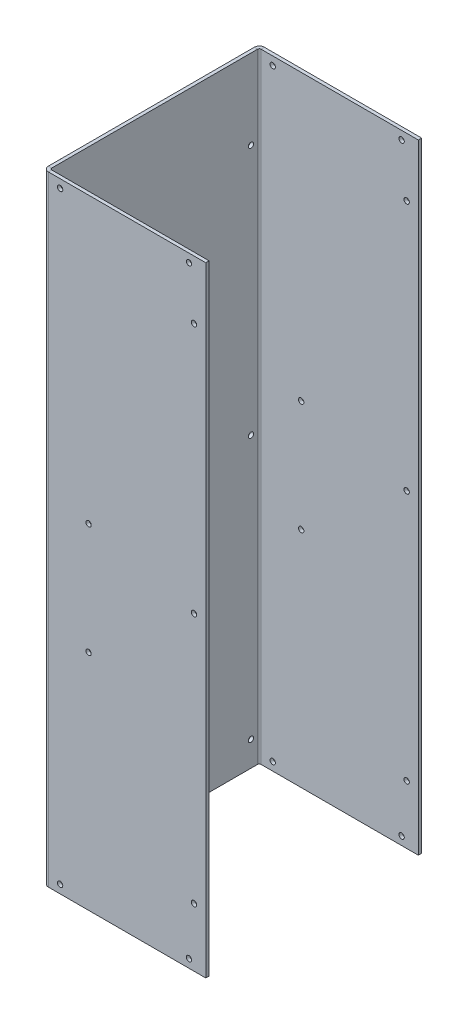
from build123d import *

# Parameters (mm, degrees)
SKETCH1_W                      = 370
SKETCH1_H                      = 129
SKETCH1_R                      = 1.6
BASE_FLANGE2_DEPTH             = 2
EDGE_FLANGE2_STRIP_W           = 9.9304
EDGE_FLANGE2_STRIP_H           = 2
EDGE_FLANGE2_STRIP_CUT_DEPTH   = 370
EDGE_FLANGE2_STRIP_2_W         = 9.9304
EDGE_FLANGE2_STRIP_2_H         = 2
EDGE_FLANGE2_STRIP_CUT_2_DEPTH = 370
EDGE_FLANGE2_DEPTH             = 370
EDGE_FLANGE2_BEND_DEPTH        = 370
SKETCH23_R                     = 1.6
CUT_EXTRUDE2_DEPTH             = 245.726377818


# Sheet-metal steps are written as plain solids
with BuildPart() as part:
    # Sketch1 → Base-Flange2 (new body)
    with BuildSketch(Plane.YZ):
        Rectangle(SKETCH1_W, SKETCH1_H)
        with Locations(Location((-170, 57.5, 0), (0, 0, 270))):
            Circle(SKETCH1_R, mode=Mode.SUBTRACT)
        with Locations(Location((137.3, 57.5, 0), (0, 0, 270))):
            Circle(SKETCH1_R, mode=Mode.SUBTRACT)
        with Locations(Location((-170, -57.5, 0), (0, 0, 270))):
            Circle(SKETCH1_R, mode=Mode.SUBTRACT)
        with Locations(Location((137.3, -57.5, 0), (0, 0, 270))):
            Circle(SKETCH1_R, mode=Mode.SUBTRACT)
        with Locations(Location((34.3, 57.5, 0), (0, 0, 270))):
            Circle(SKETCH1_R, mode=Mode.SUBTRACT)
        with Locations(Location((-12.7, -57.5, 0), (0, 0, 270))):
            Circle(SKETCH1_R, mode=Mode.SUBTRACT)
    extrude(amount=-BASE_FLANGE2_DEPTH)

    # Edge-Flange2 strip (across the edge) → Edge-Flange2 strip cut (cut)
    with BuildSketch(Plane(origin=(0, -185, -64.5), x_dir=(0, 0, 1), z_dir=(0, 1, 0))):
        with Locations((-2, -1)):
            Rectangle(EDGE_FLANGE2_STRIP_W, EDGE_FLANGE2_STRIP_H)
    extrude(amount=EDGE_FLANGE2_STRIP_CUT_DEPTH, mode=Mode.SUBTRACT)

    # Edge-Flange2 strip 2 (across the edge) → Edge-Flange2 strip cut 2 (cut)
    with BuildSketch(Plane(origin=(0, 185, 64.5), x_dir=(0, 0, -1), z_dir=(0, -1, 0))):
        with Locations((-2, -1)):
            Rectangle(EDGE_FLANGE2_STRIP_2_W, EDGE_FLANGE2_STRIP_2_H)
    extrude(amount=EDGE_FLANGE2_STRIP_CUT_2_DEPTH, mode=Mode.SUBTRACT)

    # Edge-Flange2 section (across the edge) → Edge-Flange2 (add)
    with BuildSketch(Plane(origin=(0, -185, -64.5), x_dir=(0, 0, 1), z_dir=(0, 1, 0))):
        with BuildLine():
            Line((0, 0.9652), (0, 95))
            Line((0, 95), (2, 95))
            Line((2, 95), (2, 0.9652))
            ThreePointArc((2, 0.9652), (2.282700535, 0.282700535), (2.9652, 0))
            Line((2.9652, 0), (2.9652, -2))
            ThreePointArc((2.9652, -2), (0.868486972, -1.131513028), (0, 0.9652))
        make_face()
    extrude(amount=EDGE_FLANGE2_DEPTH)

    # Edge-Flange2 section 2 (across the edge) → Edge-Flange2 bend (add)
    with BuildSketch(Plane(origin=(0, 185, 64.5), x_dir=(0, 0, -1), z_dir=(0, -1, 0))):
        with BuildLine():
            Line((0, 0.9652), (0, 95))
            Line((0, 95), (2, 95))
            Line((2, 95), (2, 0.9652))
            ThreePointArc((2, 0.9652), (2.282700535, 0.282700535), (2.9652, 0))
            Line((2.9652, 0), (2.9652, -2))
            ThreePointArc((2.9652, -2), (0.868486972, -1.131513028), (0, 0.9652))
        make_face()
    extrude(amount=EDGE_FLANGE2_BEND_DEPTH)

    # Sketch23 → Cut-Extrude2 (cut, through all)
    with BuildSketch(Plane(origin=(0, 0, -64.5), x_dir=(1, 0, 0), z_dir=(0, 0, -1))):
        with Locations(Location((88, 150, 0), (0, 0, 180))):
            Circle(SKETCH23_R)
        with Locations(Location((88, 0, 0), (0, 0, 180))):
            Circle(SKETCH23_R)
        with Locations(Location((88, -150, 0), (0, 0, 180))):
            Circle(SKETCH23_R)
        with Locations(Location((8, 180, 0), (0, 0, 180))):
            Circle(SKETCH23_R)
        with Locations(Location((85, 180, 0), (0, 0, 180))):
            Circle(SKETCH23_R)
        with Locations(Location((8, -180, 0), (0, 0, 180))):
            Circle(SKETCH23_R)
        with Locations(Location((85, -180, 0), (0, 0, 180))):
            Circle(SKETCH23_R)
        with Locations(Location((25, -15, 0), (0, 0, 180))):
            Circle(SKETCH23_R)
        with Locations(Location((25, 51.5, 0), (0, 0, 180))):
            Circle(SKETCH23_R)
    extrude(amount=-CUT_EXTRUDE2_DEPTH, mode=Mode.SUBTRACT)


solid = part.part
